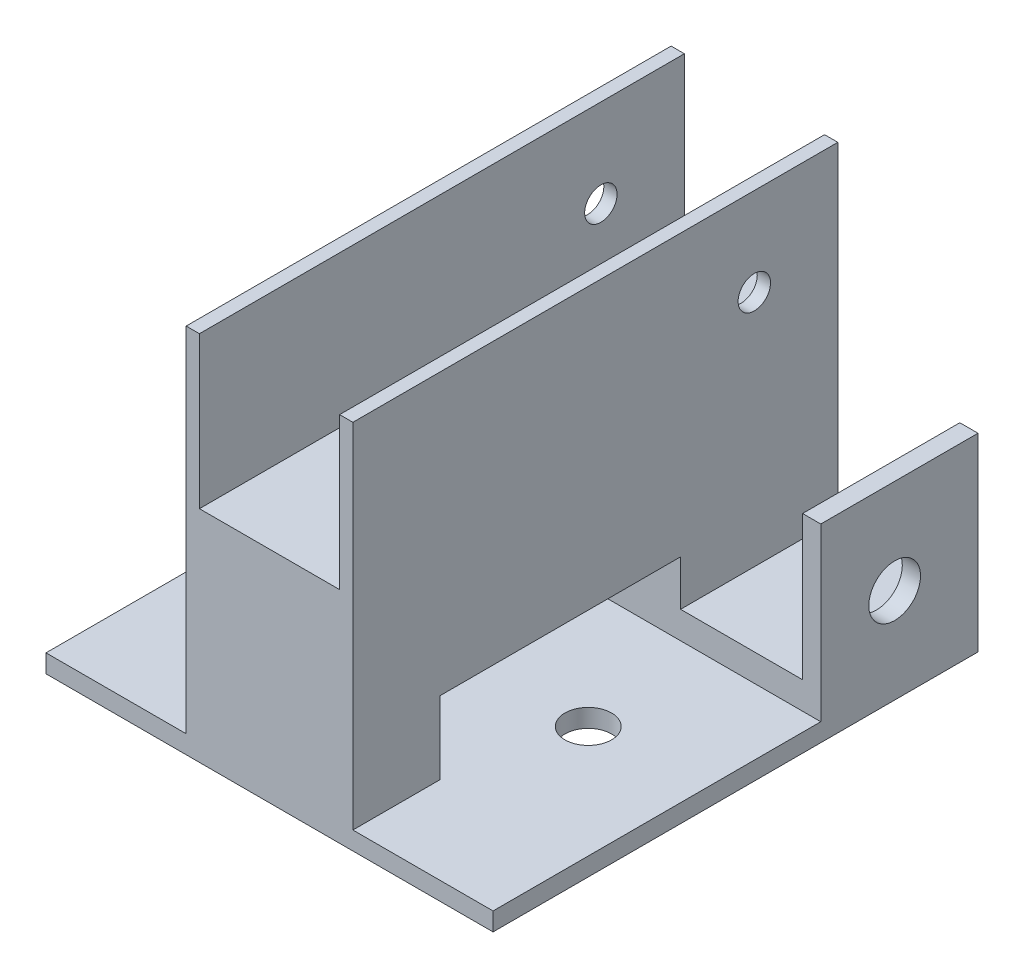
from build123d import *

# Parameters (mm, degrees)
SKETCH1_W           = 22
SKETCH1_H           = 64
BOSS_EXTRUDE2_DEPTH = 49
SKETCH3_W           = 18.5
SKETCH3_H           = 64
CUT_EXTRUDE1_DEPTH  = 20
SKETCH4_R           = 2.14
CUT_EXTRUDE2_DEPTH  = 28
SKETCH5_W           = 64
SKETCH5_H           = 6
BOSS_EXTRUDE3_DEPTH = 18.5
SKETCH6_W           = 2.4
SKETCH6_H           = 64
BOSS_EXTRUDE4_DEPTH = 19
SKETCH7_R           = 3.41
CUT_EXTRUDE3_DEPTH  = 13
SKETCH8_W           = 64
SKETCH8_H           = 6
BOSS_EXTRUDE5_DEPTH = 18.5
SKETCH9_W           = 2.4
SKETCH9_H           = 64
BOSS_EXTRUDE6_DEPTH = 19
CUT_EXTRUDE4_START  = -13.550505831
SKETCH10_R          = 3.41
CUT_EXTRUDE4_DEPTH  = 13.550505831
SKETCH12_R          = 3.075953135
CUT_EXTRUDE6_DEPTH  = 66.538156825
CUT_EXTRUDE7_REACH  = 73.171
SKETCH13_W          = 31.75
SKETCH13_H          = 6
SKETCH15_W          = 2.4
SKETCH15_H          = 43.25
CUT_EXTRUDE8_DEPTH  = 19
SKETCH16_W          = 2.4
SKETCH16_H          = 43.25
CUT_EXTRUDE9_DEPTH  = 19
CUT_EXTRUDE10_START = -3.6
SKETCH17_R          = 3.075953135
CUT_EXTRUDE10_DEPTH = 3.6


with BuildPart() as part:
    # Sketch1 → Boss-Extrude2 (new body)
    with BuildSketch(Plane(origin=(0, 0, 0), x_dir=(1, 0, 0), z_dir=(0, 1, 0))):
        Rectangle(SKETCH1_W, SKETCH1_H)
    extrude(amount=BOSS_EXTRUDE2_DEPTH)

    # Sketch3 → Cut-Extrude1 (cut)
    with BuildSketch(Plane(origin=(0, 49, 0), x_dir=(1, 0, 0), z_dir=(0, 1, 0))):
        Rectangle(SKETCH3_W, SKETCH3_H)
    extrude(amount=-CUT_EXTRUDE1_DEPTH, mode=Mode.SUBTRACT)

    # Sketch4 → Cut-Extrude2 (cut)
    with BuildSketch(Plane(origin=(11, 0, 0), x_dir=(0, 0, -1), z_dir=(1, 0, 0))):
        with Locations((20.979041052, 37.382)):
            Circle(SKETCH4_R)
    extrude(amount=-CUT_EXTRUDE2_DEPTH, mode=Mode.SUBTRACT)

    # Sketch5 → Boss-Extrude3 (add)
    with BuildSketch(Plane(origin=(11, 0, 0), x_dir=(0, 0, -1), z_dir=(1, 0, 0))):
        with Locations((0, 3)):
            Rectangle(SKETCH5_W, SKETCH5_H)
    extrude(amount=BOSS_EXTRUDE3_DEPTH)

    # Sketch6 → Boss-Extrude4 (add)
    with BuildSketch(Plane(origin=(0, 6, 0), x_dir=(1, 0, 0), z_dir=(0, 1, 0))):
        with Locations((28.3, 0)):
            Rectangle(SKETCH6_W, SKETCH6_H)
    extrude(amount=BOSS_EXTRUDE4_DEPTH)

    # Sketch7 → Cut-Extrude3 (cut)
    with BuildSketch(Plane(origin=(29.5, 0, 0), x_dir=(0, 0, -1), z_dir=(1, 0, 0))):
        with Locations((21, 12.5)):
            Circle(SKETCH7_R)
    extrude(amount=-CUT_EXTRUDE3_DEPTH, mode=Mode.SUBTRACT)

    # Sketch8 → Boss-Extrude5 (add)
    with BuildSketch(Plane.ZY.offset(11)):
        with Locations((0, 3)):
            Rectangle(SKETCH8_W, SKETCH8_H)
    extrude(amount=BOSS_EXTRUDE5_DEPTH)

    # Sketch9 → Boss-Extrude6 (add)
    with BuildSketch(Plane(origin=(0, 6, 0), x_dir=(1, 0, 0), z_dir=(0, 1, 0))):
        with Locations((-28.3, 0)):
            Rectangle(SKETCH9_W, SKETCH9_H)
    extrude(amount=BOSS_EXTRUDE6_DEPTH)

    # Sketch10 → Cut-Extrude4 (cut)
    with BuildSketch(Plane.ZY.offset(29.5).offset(CUT_EXTRUDE4_START)):
        with Locations((-21, 12.5)):
            Circle(SKETCH10_R)
    extrude(amount=CUT_EXTRUDE4_DEPTH, mode=Mode.SUBTRACT)

    # Sketch12 → Cut-Extrude6 (cut, through all)
    with BuildSketch(Plane(origin=(0, 0, 0), x_dir=(-1, 0, 0), z_dir=(0, -1, 0))):
        with Locations((14.6918, -4.628600023)):
            Circle(SKETCH12_R)
        with Locations((-14.6918, -4.628600023)):
            Circle(SKETCH12_R)
    extrude(amount=-CUT_EXTRUDE6_DEPTH, mode=Mode.SUBTRACT)

    # Sketch13 → Cut-Extrude7 (cut, up to next)
    with BuildSketch(Plane.ZY.offset(11), mode=Mode.PRIVATE) as cut_extrude7_sk1:
        with Locations((4.625, 9)):
            Rectangle(SKETCH13_W, SKETCH13_H)
    cut_extrude7_tool1 = extrude(cut_extrude7_sk1.sketch, amount=-CUT_EXTRUDE7_REACH, mode=Mode.PRIVATE) & part.part
    add(cut_extrude7_tool1.solids().sort_by_distance((-11, 9, 4.625))[0], mode=Mode.SUBTRACT)

    # Sketch15 → Cut-Extrude8 (cut)
    with BuildSketch(Plane(origin=(0, 25, 0), x_dir=(1, 0, 0), z_dir=(0, 1, 0))):
        with Locations((-28.3, -10.375)):
            Rectangle(SKETCH15_W, SKETCH15_H)
    extrude(amount=-CUT_EXTRUDE8_DEPTH, mode=Mode.SUBTRACT)

    # Sketch16 → Cut-Extrude9 (cut)
    with BuildSketch(Plane(origin=(0, 25, 0), x_dir=(1, 0, 0), z_dir=(0, 1, 0))):
        with Locations((28.3, -10.375)):
            Rectangle(SKETCH16_W, SKETCH16_H)
    extrude(amount=-CUT_EXTRUDE9_DEPTH, mode=Mode.SUBTRACT)

    # Sketch17 → Cut-Extrude10 (cut)
    with BuildSketch(Plane(origin=(0, 6, 0), x_dir=(1, 0, 0), z_dir=(0, 1, 0)).offset(CUT_EXTRUDE10_START)):
        Polygon((-29.5, 11.25), (-29.5, -32), (-11, -32), (-11, -20.5), (11, -20.5), (11, -32), (29.5, -32), (29.5, 11.25), align=None)
        with Locations((-14.6918, -4.628600023)):
            Circle(SKETCH17_R, mode=Mode.SUBTRACT)
        with Locations((14.6918, -4.628600023)):
            Circle(SKETCH17_R, mode=Mode.SUBTRACT)
    extrude(amount=CUT_EXTRUDE10_DEPTH, mode=Mode.SUBTRACT)


solid = part.part
